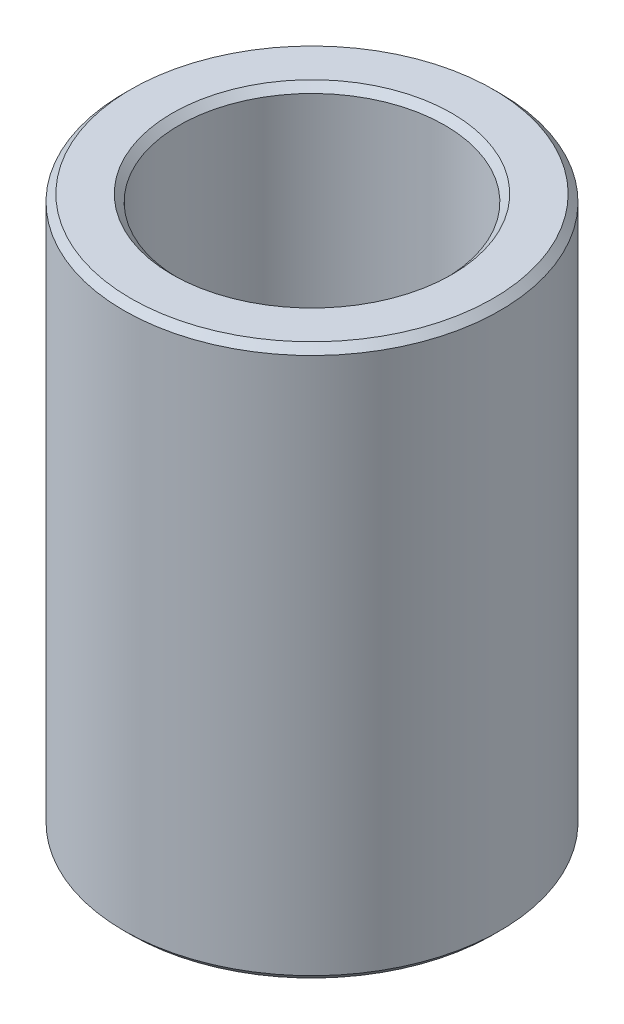
from build123d import *

# Parameters (mm, degrees)
SKETCH1_R           = 47.5
BOSS_EXTRUDE1_DEPTH = 139.138711342
SKETCH2_R           = 33.550096358
CUT_EXTRUDE1_DEPTH  = 155.505925433
CHAMFER1_SIZE       = 1.759749144


with BuildPart() as part:
    # Sketch1 → Boss-Extrude1 (new body)
    with BuildSketch(Plane(origin=(0, 0, 0), x_dir=(1, 0, 0), z_dir=(0, 1, 0))):
        Circle(SKETCH1_R)
    extrude(amount=BOSS_EXTRUDE1_DEPTH)

    # Sketch2 → Cut-Extrude1 (cut, through all)
    with BuildSketch(Plane(origin=(0, 0, 0), x_dir=(1, 0, 0), z_dir=(0, 1, 0))):
        Circle(SKETCH2_R)
    extrude(amount=CUT_EXTRUDE1_DEPTH, mode=Mode.SUBTRACT)

    # Chamfer1
    chamfer1_edges = [part.edges().sort_by_distance(p)[0] for p in [
        (-33.550096358, 139.138711342, 0),
        (-33.550096358, 0, 0),
        (-47.5, 0, 0),
        (-47.5, 139.138711342, 0),
    ]]
    chamfer(chamfer1_edges, length=CHAMFER1_SIZE)


solid = part.part
